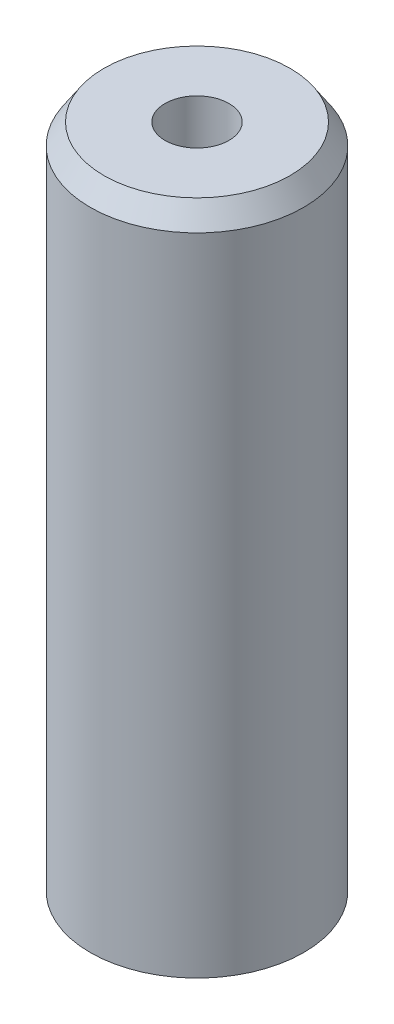
from build123d import *
from OCP.BRepFilletAPI import BRepFilletAPI_MakeChamfer

# Parameters (mm, degrees)
SKETCH1_R           = 27.5
BOSS_EXTRUDE1_DEPTH = 175.181369592
SKETCH2_R           = 8.248087334
CUT_EXTRUDE1_DEPTH  = 180.446404957
CHAMFER1_SIZE       = 5.324894339
CHAMFER1_SIZE2      = 3.527377371


with BuildPart() as part:
    # Sketch1 → Boss-Extrude1 (new body)
    with BuildSketch(Plane(origin=(0, 0, 0), x_dir=(1, 0, 0), z_dir=(0, 1, 0))):
        Circle(SKETCH1_R)
    extrude(amount=BOSS_EXTRUDE1_DEPTH)

    # Sketch2 → Cut-Extrude1 (cut, through all)
    with BuildSketch(Plane(origin=(0, 0, 0), x_dir=(1, 0, 0), z_dir=(0, 1, 0))):
        Circle(SKETCH2_R)
    extrude(amount=CUT_EXTRUDE1_DEPTH, mode=Mode.SUBTRACT)

    # Chamfer1: one chamfer whose edges measure the first distance from different faces: ONE call of the kernel's chamfer builder (chamfer() names one face for all edges)
    chamfer1_edges_1 = [part.edges().sort_by_distance(p)[0] for p in [
        (-27.5, 175.181369592, 0),
    ]]
    chamfer1_side_1 = [part.faces().sort_by_distance(p)[0] for p in [
        (-27.5, 87.590684796, 0),
    ]]
    chamfer1_edges_2 = [part.edges().sort_by_distance(p)[0] for p in [
        (-27.5, 0, 0),
    ]]
    chamfer1_side_2 = [part.faces().sort_by_distance(p)[0] for p in [
        (-26.722182541, 0, 0),
    ]]
    chamfer1 = BRepFilletAPI_MakeChamfer(part.part.solid().wrapped)
    for e in chamfer1_edges_1:
        chamfer1.Add(CHAMFER1_SIZE, CHAMFER1_SIZE2, e.wrapped, chamfer1_side_1[0].wrapped)  # the first distance lies on this face
    for e in chamfer1_edges_2:
        chamfer1.Add(CHAMFER1_SIZE, CHAMFER1_SIZE2, e.wrapped, chamfer1_side_2[0].wrapped)  # the first distance lies on this face
    add(Compound.cast(chamfer1.Shape()), mode=Mode.REPLACE)


solid = part.part
